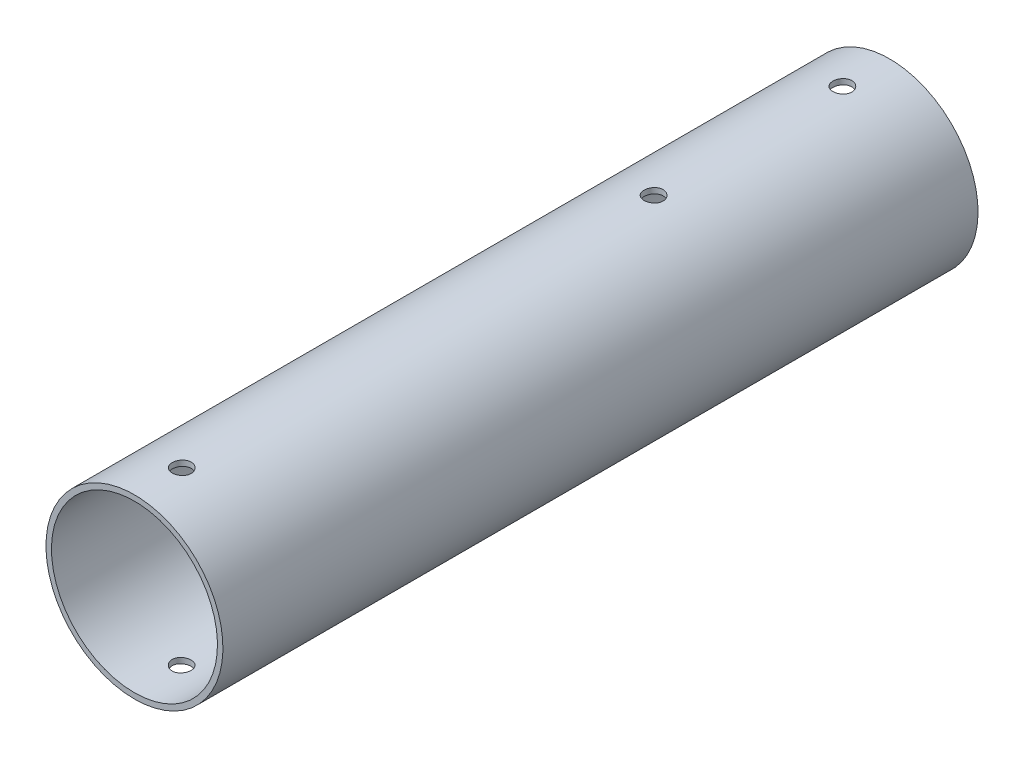
from build123d import *

# Parameters (mm, degrees)
SKETCH3_W               = 203.2
SKETCH3_H               = 1.4732
CUT_EXTRUDE1_DEPTH      = 108.035649727
CUT_EXTRUDE1_DEPTH_BACK = 108.035649727
SKETCH4_R               = 2.5527
CUT_EXTRUDE2_DEPTH      = 108.035649867


with BuildPart() as part:
    # Sketch3 → Revolve1 (revolve)
    with BuildSketch(Plane(origin=(0, 0, 0), x_dir=(0, 0, -1), z_dir=(1, 0, 0))):
        with Locations((0, 23.0759)):
            Rectangle(SKETCH3_W, SKETCH3_H)
    revolve(axis=Axis((0, 0, 101.6), (0, 0, -1)))

    # Sketch4 → Cut-Extrude1 (cut, two sides: drawn at the far end of the back side and taken through both)
    with BuildSketch(Plane(origin=(0, 0, 0), x_dir=(1, 0, 0), z_dir=(0, 1, 0)).offset(-CUT_EXTRUDE1_DEPTH_BACK)):
        with Locations((0, 88.9)):
            Circle(SKETCH4_R)
        with Locations((0, 38.1)):
            Circle(SKETCH4_R)
        with Locations((0, -88.9)):
            Circle(SKETCH4_R)
    extrude(amount=CUT_EXTRUDE1_DEPTH + CUT_EXTRUDE1_DEPTH_BACK, mode=Mode.SUBTRACT)

    # Sketch5 → Cut-Extrude2 (cut, through all)
    with BuildSketch(Plane(origin=(0, 0, 0), x_dir=(1, 0, 0), z_dir=(0, 1, 0))):
        with BuildLine():
            Line((9.525, -19.05), (-9.525, -19.05))
            ThreePointArc((-9.525, -19.05), (-11.77006403, -18.12006403), (-12.7, -15.875))
            Line((-12.7, -15.875), (-12.7, 15.875))
            ThreePointArc((-12.7, 15.875), (-11.77006403, 18.12006403), (-9.525, 19.05))
            Line((-9.525, 19.05), (9.525, 19.05))
            ThreePointArc((9.525, 19.05), (11.77006403, 18.12006403), (12.7, 15.875))
            Line((12.7, 15.875), (12.7, -15.875))
            ThreePointArc((12.7, -15.875), (11.77006403, -18.12006403), (9.525, -19.05))
        make_face()
    extrude(amount=-CUT_EXTRUDE2_DEPTH, mode=Mode.SUBTRACT)


solid = part.part
